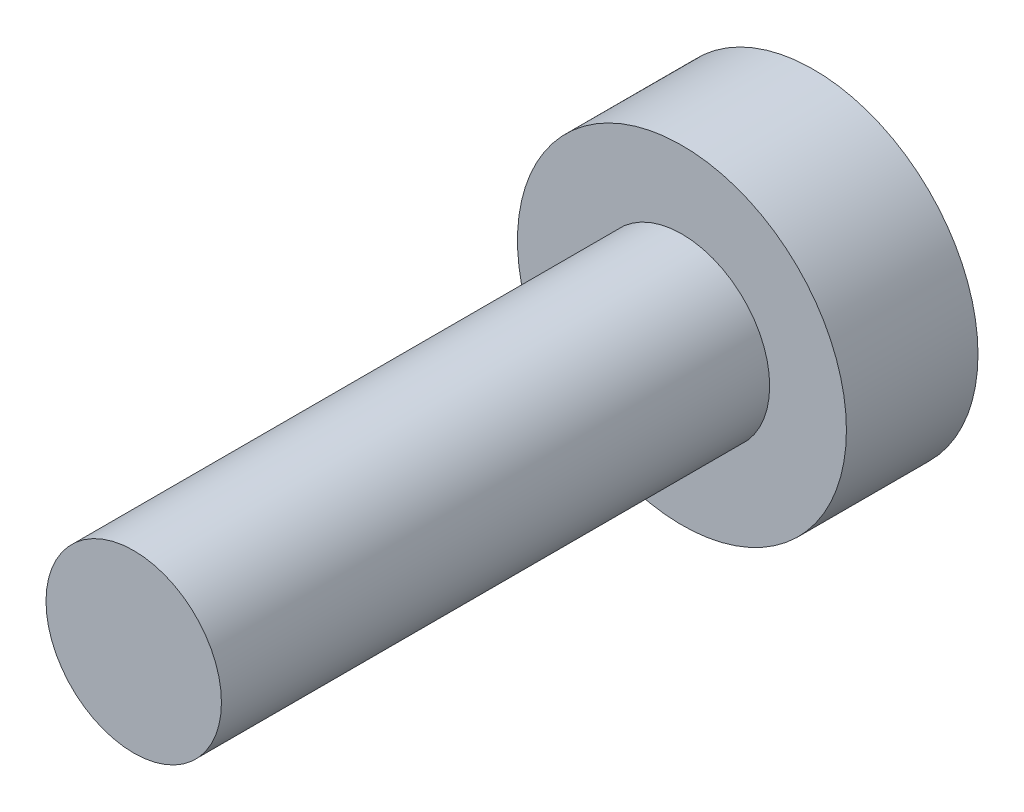
from build123d import *

# Parameters (mm, degrees)
PROFILE_SHANK_1P6_LENGTH_5_R = 0.8
SHANK_1P6_LENGTH_5_DEPTH     = 5
PROFILE_HEAD_D3_HEIGHT_1P2_R = 1.5
HEAD_D3_HEIGHT_1P2_DEPTH     = 1.2


with BuildPart() as part:
    # Profile_Shank_1p6_length_5 → Shank_1p6_length_5 (new body)
    with BuildSketch(Plane.XY):
        Circle(PROFILE_SHANK_1P6_LENGTH_5_R)
    extrude(amount=SHANK_1P6_LENGTH_5_DEPTH)

    # Profile_Head_d3_height_1p2 → Head_d3_height_1p2 (add)
    with BuildSketch(Plane.XY):
        Circle(PROFILE_HEAD_D3_HEIGHT_1P2_R)
    extrude(amount=-HEAD_D3_HEIGHT_1P2_DEPTH)


solid = part.part
